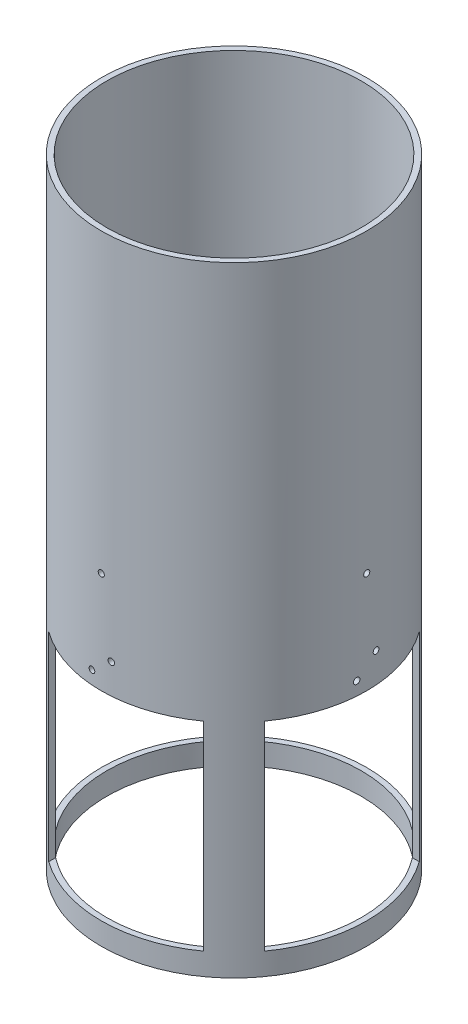
from build123d import *

# Parameters (mm, degrees)
SKETCH1_R           = 76.2
SKETCH1_R_2         = 73.025
BOSS_EXTRUDE1_DEPTH = 355.6
SKETCH6_W           = 88.9
SKETCH6_H           = 114.3
CUT_EXTRUDE6_DEPTH  = 20.574
CIRPATTERN9_COUNT   = 4
SKETCH7_R           = 1.7526
CUT_EXTRUDE7_DEPTH  = 17.78
CIRPATTERN10_COUNT  = 4


with BuildPart() as part:
    # Sketch1 → Boss-Extrude1 (new body)
    with BuildSketch(Plane(origin=(0, 0, 0), x_dir=(1, 0, 0), z_dir=(0, 1, 0))):
        Circle(SKETCH1_R)
        Circle(SKETCH1_R_2, mode=Mode.SUBTRACT)
    extrude(amount=BOSS_EXTRUDE1_DEPTH)

    # Sketch6 → Cut-Extrude6 (cut)
    with BuildSketch(Plane(origin=(0, 0, -76.2), x_dir=(-1, 0, 0), z_dir=(0, 0, -1))):
        with Locations((0, 69.85)):
            Rectangle(SKETCH6_W, SKETCH6_H)
    cut_extrude6 = extrude(amount=-CUT_EXTRUDE6_DEPTH, mode=Mode.SUBTRACT)

    # CirPattern9: Cut-Extrude6 ×4 about axis
    cirpattern9_axis = Axis((0, 0, 0), (0, 1, 0))
    for i in range(1, CIRPATTERN9_COUNT):
        add(cut_extrude6.rotate(cirpattern9_axis, i * 360 / CIRPATTERN9_COUNT), mode=Mode.SUBTRACT)

    # Sketch7 → Cut-Extrude7 (cut)
    with BuildSketch(Plane(origin=(0, 0, -76.2), x_dir=(-1, 0, 0), z_dir=(0, 0, -1))):
        with Locations((0, 185.42)):
            Circle(SKETCH7_R)
        with Locations((5.55625, 144.145)):
            Circle(SKETCH7_R)
        with Locations((-5.55625, 134.62)):
            Circle(SKETCH7_R)
    cut_extrude7 = extrude(amount=-CUT_EXTRUDE7_DEPTH, mode=Mode.SUBTRACT)

    # CirPattern10: Cut-Extrude7 ×4 about axis
    cirpattern10_axis = Axis((0, 355.6, 0), (0, 1, 0))
    for i in range(1, CIRPATTERN10_COUNT):
        add(cut_extrude7.rotate(cirpattern10_axis, i * 360 / CIRPATTERN10_COUNT), mode=Mode.SUBTRACT)


solid = part.part
